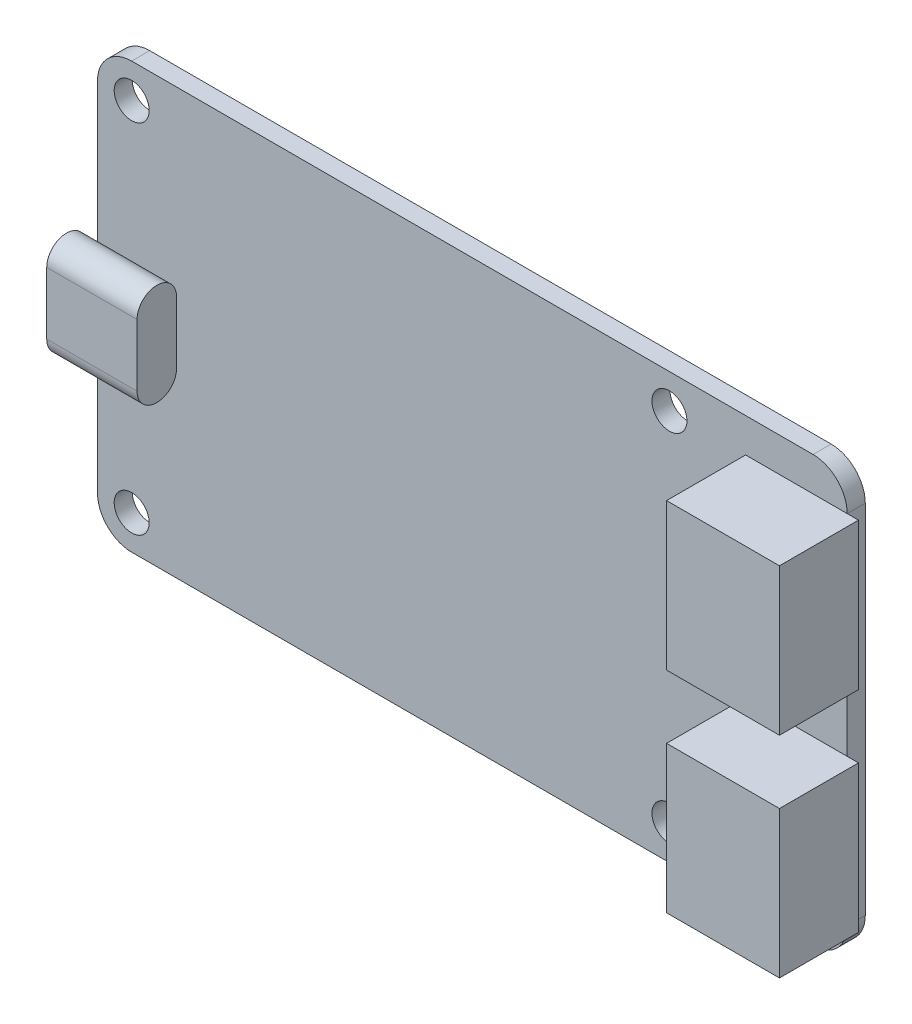
from build123d import *

# Parameters (mm, degrees)
ESBO_O1_R                     = 1.55
RESSALTO_EXTRUS_O1_DEPTH      = 1.6
ESBO_O2_W                     = 10
ESBO_O2_H                     = 13
RESSALTO_EXTRUS_O2_DEPTH      = 7
RESSALTO_EXTRUS_O3_DEPTH      = 1
RESSALTO_EXTRUS_O3_DEPTH_BACK = 7


with BuildPart() as part:
    # Esboço1 → Ressalto-extrusão1 (new body)
    with BuildSketch(Plane.XY):
        with BuildLine():
            Line((-30.175, 18.835), (30.175, 18.835))
            ThreePointArc((30.175, 18.835), (32.313998013, 17.948998013), (33.2, 15.81))
            Line((33.2, 15.81), (33.2, -15.81))
            ThreePointArc((33.2, -15.81), (32.313998013, -17.948998013), (30.175, -18.835))
            Line((30.175, -18.835), (-30.175, -18.835))
            ThreePointArc((-30.175, -18.835), (-32.313998013, -17.948998013), (-33.2, -15.81))
            Line((-33.2, -15.81), (-33.2, 15.81))
            ThreePointArc((-33.2, 15.81), (-32.313998013, 17.948998013), (-30.175, 18.835))
        make_face()
        with Locations((-30.175, 15.81)):
            Circle(ESBO_O1_R, mode=Mode.SUBTRACT)
        with Locations((-30.175, -15.81)):
            Circle(ESBO_O1_R, mode=Mode.SUBTRACT)
        with Locations((17.455, 15.81)):
            Circle(ESBO_O1_R, mode=Mode.SUBTRACT)
        with Locations((17.455, -15.81)):
            Circle(ESBO_O1_R, mode=Mode.SUBTRACT)
    extrude(amount=RESSALTO_EXTRUS_O1_DEPTH)

    # Esboço2 → Ressalto-extrusão2 (add)
    with BuildSketch(Plane.XY.offset(1.6)):
        with Locations((29.2, 9.31)):
            Rectangle(ESBO_O2_W, ESBO_O2_H)
        with Locations((29.2, -9.31)):
            Rectangle(ESBO_O2_W, ESBO_O2_H)
    extrude(amount=RESSALTO_EXTRUS_O2_DEPTH)

    # Esboço3 → Ressalto-extrusão3 (add, two sides: drawn at the far end of the back side and taken through both)
    with BuildSketch(Plane.ZY.offset(33.2).offset(-RESSALTO_EXTRUS_O3_DEPTH_BACK)):
        with BuildLine():
            Line((5.1, 2.75), (5.1, -2.75))
            ThreePointArc((5.1, -2.75), (3.35, -4.5), (1.6, -2.75))
            Line((1.6, -2.75), (1.6, 2.75))
            ThreePointArc((1.6, 2.75), (3.35, 4.5), (5.1, 2.75))
        make_face()
    extrude(amount=RESSALTO_EXTRUS_O3_DEPTH + RESSALTO_EXTRUS_O3_DEPTH_BACK)


solid = part.part
